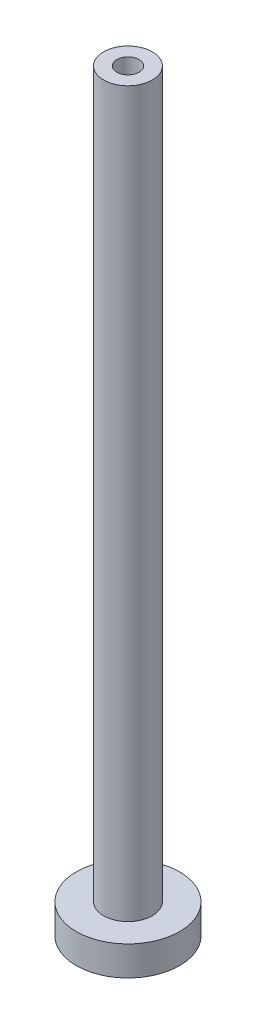
from build123d import *

# Parameters (mm, degrees)
SKETCH1_R           = 7
BOSS_EXTRUDE1_DEPTH = 4
SKETCH2_R           = 3.3
BOSS_EXTRUDE2_DEPTH = 86
SKETCH3_R           = 3.3
BOSS_EXTRUDE3_DEPTH = 12
SKETCH4_R           = 1.5
CUT_EXTRUDE2_DEPTH  = 103.479266196


with BuildPart() as part:
    # Sketch1 → Boss-Extrude1 (new body)
    with BuildSketch(Plane(origin=(0, 0, 0), x_dir=(1, 0, 0), z_dir=(0, 1, 0))):
        Circle(SKETCH1_R)
    extrude(amount=BOSS_EXTRUDE1_DEPTH)

    # Sketch2 → Boss-Extrude2 (add)
    with BuildSketch(Plane(origin=(0, 4, 0), x_dir=(1, 0, 0), z_dir=(0, 1, 0))):
        Circle(SKETCH2_R)
    extrude(amount=BOSS_EXTRUDE2_DEPTH)

    # Sketch3 → Boss-Extrude3 (add)
    with BuildSketch(Plane(origin=(0, 90, 0), x_dir=(1, 0, 0), z_dir=(0, 1, 0))):
        Circle(SKETCH3_R)
    extrude(amount=BOSS_EXTRUDE3_DEPTH)

    # Sketch4 → Cut-Extrude2 (cut, through all)
    with BuildSketch(Plane(origin=(0, 102, 0), x_dir=(1, 0, 0), z_dir=(0, 1, 0))):
        Circle(SKETCH4_R)
    extrude(amount=-CUT_EXTRUDE2_DEPTH, mode=Mode.SUBTRACT)


solid = part.part
